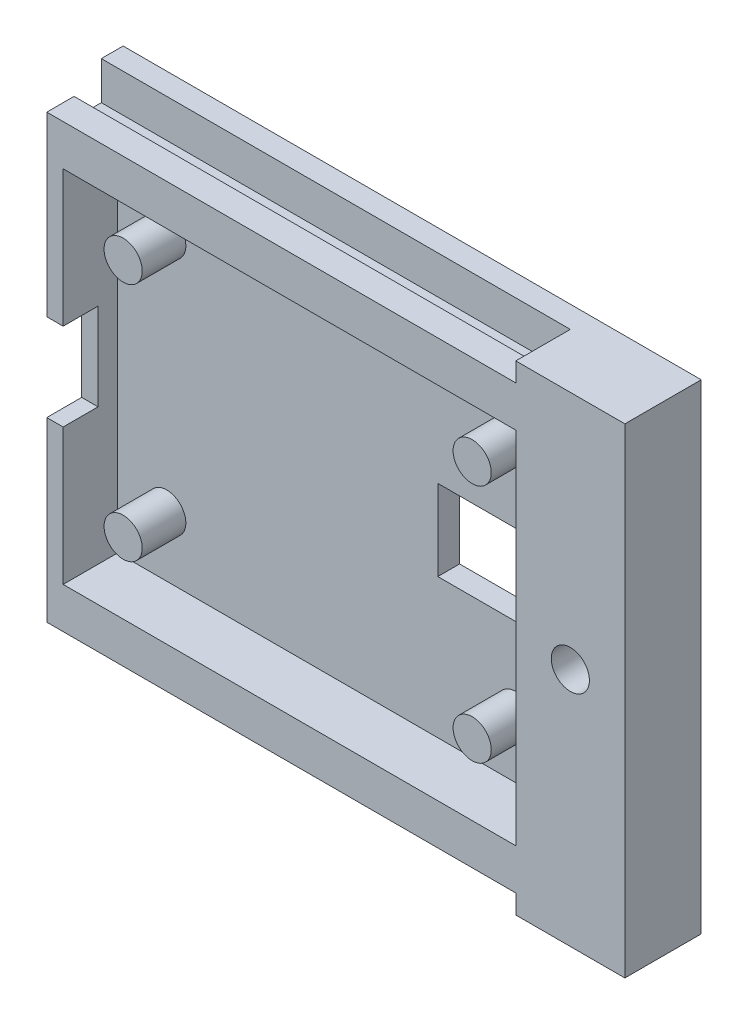
from build123d import *
from build123d.topology import SkipClean

# Parameters (mm, degrees)
CROQUIS1_W              = 53
CROQUIS1_H              = 44
CROQUIS1_W_2            = 7.4
CROQUIS1_H_2            = 7.4
SALIENTE_EXTRUIR1_DEPTH = 2
CROQUIS4_R              = 1.75
SALIENTE_EXTRUIR3_DEPTH = 4
CORTAR_EXTRUIR1_REACH   = 40.484
CROQUIS5_R              = 1.75
CROQUIS6_R              = 1.75
CROQUIS6_W              = 41.5
CROQUIS6_H              = 33
SALIENTE_EXTRUIR4_DEPTH = 5
CROQUIS7_W              = 43
CROQUIS7_H              = 1.75
SALIENTE_EXTRUIR5_DEPTH = 2.5
CROQUIS8_W              = 1.5
CROQUIS8_H              = 8
CORTAR_EXTRUIR3_DEPTH   = 3.2
CROQUIS9_R              = 3.5
CORTAR_EXTRUIR4_DEPTH   = 3


with BuildPart() as part:
    # Croquis1 → Saliente-Extruir1 (new body)
    with BuildSketch(Plane.XY):
        with Locations((4.5, 0)):
            Rectangle(CROQUIS1_W, CROQUIS1_H)
        with Locations((12.55, 0)):
            Rectangle(CROQUIS1_W_2, CROQUIS1_H_2, mode=Mode.SUBTRACT)
    extrude(amount=SALIENTE_EXTRUIR1_DEPTH)

    # Croquis4 → Saliente-Extruir3 (add)
    with BuildSketch(Plane.XY.offset(2)):
        with Locations((-16, -11)):
            Circle(CROQUIS4_R)
        with Locations((16, -11)):
            Circle(CROQUIS4_R)
        with Locations((16, 11)):
            Circle(CROQUIS4_R)
        with Locations((-16, 11)):
            Circle(CROQUIS4_R)
    extrude(amount=SALIENTE_EXTRUIR3_DEPTH)

    # Croquis5 → Cortar-Extruir1 (cut, up to next)
    with BuildSketch(Plane(origin=(0, 0, 0), x_dir=(-1, 0, 0), z_dir=(0, 0, -1)), mode=Mode.PRIVATE) as cortar_extruir1_sk1:
        with Locations((-26, 0)):
            Circle(CROQUIS5_R)
    cortar_extruir1_tool1 = extrude(cortar_extruir1_sk1.sketch, amount=-CORTAR_EXTRUIR1_REACH, mode=Mode.PRIVATE) & part.part
    add(cortar_extruir1_tool1.solids().sort_by_distance((26, 0, 0))[0], mode=Mode.SUBTRACT)

    # Croquis6 → Saliente-Extruir4 (add)
    with SkipClean():  # the faces are left unmerged after this step: merging them gives an invalid solid
        with BuildSketch(Plane.XY.offset(2)):
            Polygon((-22, -18.5), (21, -18.5), (21, -22), (31, -22), (31, 22), (21, 22), (21, 18.5), (-22, 18.5), align=None)
            with Locations((26, 0)):
                Circle(CROQUIS6_R, mode=Mode.SUBTRACT)
            with Locations((0.25, 0)):
                Rectangle(CROQUIS6_W, CROQUIS6_H, mode=Mode.SUBTRACT)
        extrude(amount=SALIENTE_EXTRUIR4_DEPTH)

    # Croquis7 → Saliente-Extruir5 (add)
    with SkipClean():  # the faces are left unmerged after this step: merging them gives an invalid solid
        with BuildSketch(Plane.XY.offset(7)):
            with Locations((-0.5, 19.375)):
                Rectangle(CROQUIS7_W, CROQUIS7_H)
            with Locations((-0.5, -19.375)):
                Rectangle(CROQUIS7_W, CROQUIS7_H)
        extrude(amount=-SALIENTE_EXTRUIR5_DEPTH)

    # Croquis8 → Cortar-Extruir3 (cut)
    with SkipClean():  # the faces are left unmerged after this step: merging them gives an invalid solid
        with BuildSketch(Plane.XY.offset(7)):
            with Locations((-21.25, 0)):
                Rectangle(CROQUIS8_W, CROQUIS8_H)
        extrude(amount=-CORTAR_EXTRUIR3_DEPTH, mode=Mode.SUBTRACT)

    # Croquis9 → Cortar-Extruir4 (cut)
    with BuildSketch(Plane(origin=(0, 0, 0), x_dir=(-1, 0, 0), z_dir=(0, 0, -1))):
        with Locations((-26, 0)):
            Circle(CROQUIS9_R)
    extrude(amount=-CORTAR_EXTRUIR4_DEPTH, mode=Mode.SUBTRACT)


solid = part.part
